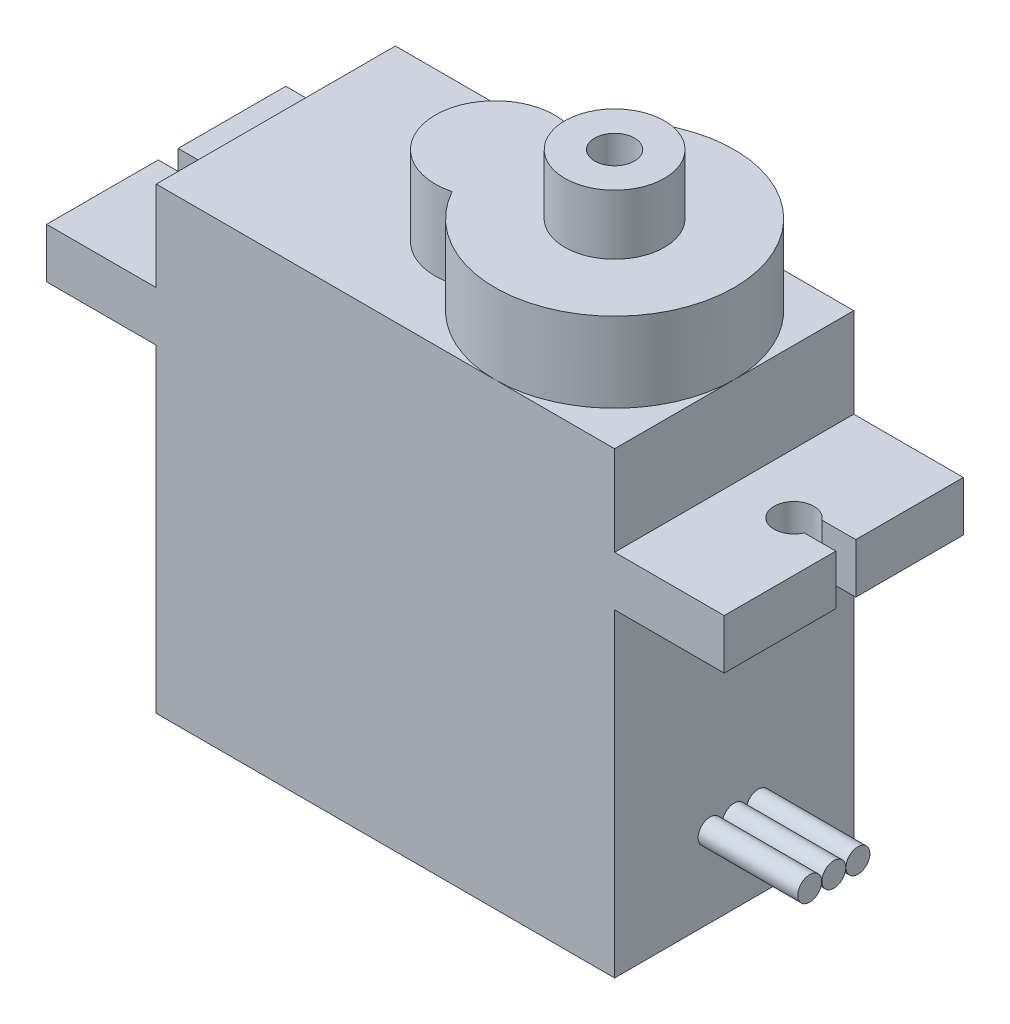
from build123d import *

# Parameters (mm, degrees)
SKETCH1_W           = 23
SKETCH1_H           = 12
BOSS_EXTRUDE1_DEPTH = 23
SKETCH2_W           = 12
SKETCH2_H           = 2.5
BOSS_EXTRUDE2_DEPTH = 5.5
CUT_EXTRUDE1_DEPTH  = 5
BOSS_EXTRUDE3_DEPTH = 4
SKETCH5_R           = 2.5
SKETCH5_R_2         = 1
BOSS_EXTRUDE4_DEPTH = 3
SKETCH7_R           = 0.6
BOSS_EXTRUDE8_DEPTH = 5


with BuildPart() as part:
    # Sketch1 → Boss-Extrude1 (new body)
    with BuildSketch(Plane(origin=(0, 0, 0), x_dir=(1, 0, 0), z_dir=(0, 1, 0))):
        Rectangle(SKETCH1_W, SKETCH1_H)
    extrude(amount=BOSS_EXTRUDE1_DEPTH)

    # Sketch2 → Boss-Extrude2 (add)
    with BuildSketch(Plane.ZY.offset(11.5)):
        with Locations((0, 17.25)):
            Rectangle(SKETCH2_W, SKETCH2_H)
    boss_extrude2 = extrude(amount=BOSS_EXTRUDE2_DEPTH)

    # Sketch3 → Cut-Extrude1 (cut)
    with BuildSketch(Plane(origin=(0, 18.5, 0), x_dir=(1, 0, 0), z_dir=(0, 1, 0))):
        with BuildLine():
            Line((-17, 0.6), (-15.3, 0.6))
            ThreePointArc((-15.3, 0.6), (-13.506719548, -0.11573221), (-15.416515139, -0.4))
            Line((-15.416515139, -0.4), (-17, -0.4))
            Line((-17, -0.4), (-17, 0.6))
        make_face()
    cut_extrude1 = extrude(amount=-CUT_EXTRUDE1_DEPTH, mode=Mode.SUBTRACT)

    # Mirror1: Boss-Extrude2, Cut-Extrude1 across plane
    add(boss_extrude2.mirror(Plane(origin=(0, 0, 0), x_dir=(0, 0, 1), z_dir=(1, 0, 0))))
    add(cut_extrude1.mirror(Plane(origin=(0, 0, 0), x_dir=(0, 0, 1), z_dir=(1, 0, 0))), mode=Mode.SUBTRACT)

    # Sketch4 → Boss-Extrude3 (add)
    with BuildSketch(Plane(origin=(0, 23, 0), x_dir=(1, 0, 0), z_dir=(0, 1, 0))):
        with BuildLine():
            ThreePointArc((0.25, -2.90473751), (11.5, 0), (0.25, 2.90473751))
            ThreePointArc((0.25, 2.90473751), (-3.5, 0), (0.25, -2.90473751))
        make_face()
    extrude(amount=BOSS_EXTRUDE3_DEPTH)

    # Sketch5 → Boss-Extrude4 (add)
    with BuildSketch(Plane(origin=(0, 27, 0), x_dir=(1, 0, 0), z_dir=(0, 1, 0))):
        with Locations((5.5, 0)):
            Circle(SKETCH5_R)
        with Locations((5.5, 0)):
            Circle(SKETCH5_R_2, mode=Mode.SUBTRACT)
    extrude(amount=BOSS_EXTRUDE4_DEPTH)

    # Sketch7 → Boss-Extrude8 (add)
    with BuildSketch(Plane(origin=(11.5, 0, 0), x_dir=(0, 0, -1), z_dir=(1, 0, 0))):
        with Locations((0, 4)):
            Circle(SKETCH7_R)
        with Locations((1.21, 4)):
            Circle(SKETCH7_R)
        with Locations((-1.21, 4)):
            Circle(SKETCH7_R)
    extrude(amount=BOSS_EXTRUDE8_DEPTH)


solid = part.part
